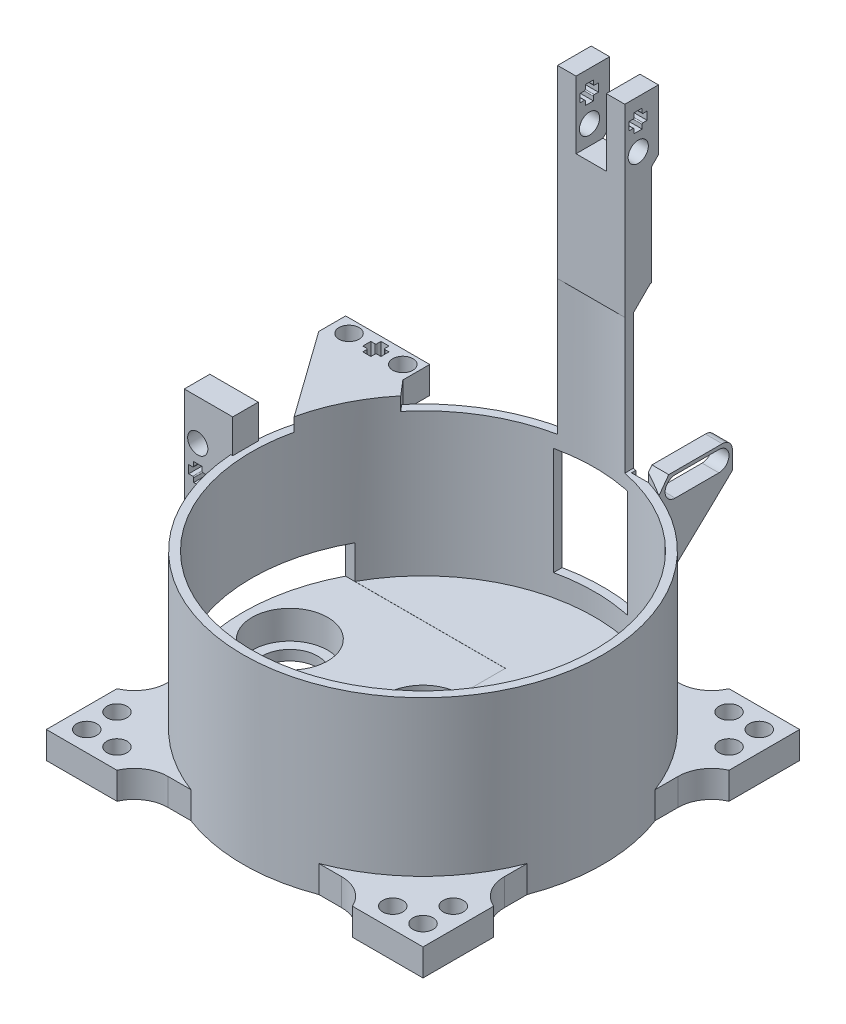
from build123d import *
from build123d.topology import SkipClean

# Parameters (mm, degrees)
SKETCH1_R                 = 53.5
SKETCH1_R_2               = 8.25
BOSS_EXTRUDE1_DEPTH       = 3
SKETCH2_R                 = 53.5
SKETCH2_R_2               = 11.25
BOSS_EXTRUDE2_DEPTH       = 8.5
SKETCH3_R                 = 53.5
SKETCH3_R_2               = 51
BOSS_EXTRUDE3_DEPTH       = 42.5
SKETCH6_W                 = 22
SKETCH6_H                 = 22
CUT_EXTRUDE1_DEPTH        = 85.5
SKETCH7_W                 = 49
SKETCH7_H                 = 10
CUT_EXTRUDE2_DEPTH        = 120
BOSS_EXTRUDE4_DEPTH       = 10
BOSS_EXTRUDE4_DEPTH_BACK  = 29
SKETCH8_W                 = 14.399157
SKETCH8_H                 = 7.6
SKETCH9_R                 = 3
CUT_EXTRUDE3_DEPTH        = 46
BOSS_EXTRUDE6_DEPTH       = 4
BOSS_EXTRUDE6_DEPTH_BACK  = 4
SKETCH12_R                = 3
BOSS_EXTRUDE7_START       = 0.1
BOSS_EXTRUDE7_DEPTH       = 0.1
CHAMFER1_START            = 48.189598
CHAMFER1_DEPTH            = 1.710402
CHAMFER1_START_2          = 25.9
CHAMFER1_2_DEPTH          = 22.289598
CHAMFER1_3_ANGLE          = 25.455109
SKETCH15_R                = 3
BOSS_EXTRUDE9_DEPTH       = 8
FILLET2_R                 = 10
BOSS_EXTRUDE10_DEPTH      = 95
BOSS_EXTRUDE13_DEPTH      = 10
BOSS_EXTRUDE13_DEPTH_BACK = 10
SKETCH19_R                = 3
CUT_EXTRUDE4_DEPTH        = 20
SKETCH20_W                = 9
SKETCH20_H                = 10
CUT_EXTRUDE5_DEPTH        = 20
BOSS_EXTRUDE14_START      = -8
BOSS_EXTRUDE14_DEPTH      = 8
CUT_EXTRUDE6_DEPTH        = 10
CHAMFER2_SIZE             = 21
FILLET3_R                 = 3
CUT_EXTRUDE7_REACH        = 180.543
CUT_EXTRUDE7_END_RADIUS   = 53.5
SKETCH27_W                = 22
SKETCH27_H                = 10


with BuildPart() as part:
    # Sketch1 → Boss-Extrude1 (new body)
    with BuildSketch(Plane(origin=(0, 0, 0), x_dir=(1, 0, 0), z_dir=(0, 1, 0))):
        with Locations(Location((0, 0, 0), (0, 0, 270))):
            Circle(SKETCH1_R)
        with Locations(Location((0, 0, 0), (0, 0, 270))):
            Circle(SKETCH1_R_2, mode=Mode.SUBTRACT)
        with Locations(Location((-39.59108, 0, 0), (0, 0, 270))):
            Circle(SKETCH1_R_2, mode=Mode.SUBTRACT)
    extrude(amount=BOSS_EXTRUDE1_DEPTH)

    # Sketch2 → Boss-Extrude2 (add)
    with BuildSketch(Plane(origin=(0, 3, 0), x_dir=(1, 0, 0), z_dir=(0, 1, 0))):
        with Locations(Location((0, 0, 0), (0, 0, 270))):
            Circle(SKETCH2_R)
        with Locations(Location((0, 0, 0), (0, 0, 270))):
            Circle(SKETCH2_R_2, mode=Mode.SUBTRACT)
        with Locations(Location((-39.59108, 0, 0), (0, 0, 270))):
            Circle(SKETCH2_R_2, mode=Mode.SUBTRACT)
    extrude(amount=BOSS_EXTRUDE2_DEPTH)

    # Sketch3 → Boss-Extrude3 (add)
    with BuildSketch(Plane(origin=(0, 11.5, 0), x_dir=(1, 0, 0), z_dir=(0, 1, 0))):
        with Locations(Location((0, 0, 0), (0, 0, 270))):
            Circle(SKETCH3_R)
        with Locations(Location((0, 0, 0), (0, 0, 270))):
            Circle(SKETCH3_R_2, mode=Mode.SUBTRACT)
    extrude(amount=BOSS_EXTRUDE3_DEPTH)

    # Sketch6 → Cut-Extrude1 (cut)
    with BuildSketch(Plane.XY):
        with Locations((0, 39)):
            Rectangle(SKETCH6_W, SKETCH6_H)
    extrude(amount=-CUT_EXTRUDE1_DEPTH, mode=Mode.SUBTRACT)

    # Sketch7 → Cut-Extrude2 (cut)
    with BuildSketch(Plane(origin=(0, 0, 0), x_dir=(0, 0, -1), z_dir=(1, 0, 0))):
        with Locations((0, 16.46402)):
            Rectangle(SKETCH7_W, SKETCH7_H)
    extrude(amount=-CUT_EXTRUDE2_DEPTH, mode=Mode.SUBTRACT)

    # Sketch8 → Boss-Extrude4 (add, two sides: drawn at the far end of the back side and taken through both)
    with BuildSketch(Plane(origin=(0, 54, 0), x_dir=(1, 0, 0), z_dir=(0, 1, 0)).offset(-BOSS_EXTRUDE4_DEPTH_BACK)):
        with Locations((-59.982582, 0)):
            Rectangle(SKETCH8_W, SKETCH8_H)
    extrude(amount=BOSS_EXTRUDE4_DEPTH + BOSS_EXTRUDE4_DEPTH_BACK)

    # Sketch9 → Cut-Extrude3 (cut)
    with BuildSketch(Plane(origin=(0, 0, -3.8), x_dir=(-1, 0, 0), z_dir=(0, 0, -1))):
        with BuildLine():
            Line((66.182161, 52), (63.182161, 52))
            Line((63.182161, 52), (63.182161, 55))
            ThreePointArc((63.182161, 55), (61.06084, 49.87868), (66.182161, 52))
        make_face()
        with BuildLine():
            Line((63.182161, 55), (63.182161, 52))
            Line((63.182161, 52), (66.182161, 52))
            ThreePointArc((66.182161, 52), (65.303481, 54.12132), (63.182161, 55))
        make_face()
        with BuildLine():
            Line((64.371816, 41.302276), (64.371816, 42.502276))
            ThreePointArc((64.371816, 42.502276), (64.459684, 42.714409), (64.671816, 42.802276))
            Line((64.671816, 42.802276), (65.871816, 42.802276))
            Line((65.871816, 42.802276), (65.871816, 45.202276))
            Line((65.871816, 45.202276), (64.671816, 45.202276))
            ThreePointArc((64.671816, 45.202276), (64.459684, 45.290144), (64.371816, 45.502276))
            Line((64.371816, 45.502276), (64.371816, 46.702276))
            Line((64.371816, 46.702276), (61.971816, 46.702276))
            Line((61.971816, 46.702276), (61.971816, 45.502276))
            ThreePointArc((61.971816, 45.502276), (61.883948, 45.290144), (61.671816, 45.202276))
            Line((61.671816, 45.202276), (60.471816, 45.202276))
            Line((60.471816, 45.202276), (60.471816, 42.802276))
            Line((60.471816, 42.802276), (61.671816, 42.802276))
            ThreePointArc((61.671816, 42.802276), (61.883948, 42.714409), (61.971816, 42.502276))
            Line((61.971816, 42.502276), (61.971816, 41.302276))
            Line((61.971816, 41.302276), (64.371816, 41.302276))
        make_face()
        with Locations((63.182161, 36)):
            Circle(SKETCH9_R)
    extrude(amount=-CUT_EXTRUDE3_DEPTH, mode=Mode.SUBTRACT)

    # Sketch12 → Boss-Extrude6 (add, two sides: drawn at the far end of the back side and taken through both)
    # profile 1 of 2: a face of its own
    with SkipClean():  # the faces are left unmerged after this step: merging them gives an invalid solid
        with BuildSketch(Plane(origin=(0, 54, 0), x_dir=(1, 0, 0), z_dir=(0, 1, 0)).offset(-BOSS_EXTRUDE6_DEPTH_BACK)):
            with BuildLine():
                Line((-43, 41), (-43, 45))
                Line((-43, 45), (-47, 45))
                Line((-47, 45), (-68, 45))
                Line((-68, 45), (-68, 37))
                Line((-68, 37), (-51.614712, 14.077339))
                ThreePointArc((-51.614712, 14.077339), (-47.35959, 24.886126), (-40.871779, 34.521698))
                Line((-40.871779, 34.521698), (-43, 37))
                Line((-43, 37), (-43, 41))
            make_face()
            with Locations(Location((-63, 41, 0), (0, 0, 270))):
                Circle(SKETCH12_R, mode=Mode.SUBTRACT)
            with BuildLine():
                Line((-56.497724, 39.789656), (-57.697724, 39.789656))
                Line((-57.697724, 39.789656), (-57.697724, 42.189656))
                Line((-57.697724, 42.189656), (-56.497724, 42.189656))
                ThreePointArc((-56.497724, 42.189656), (-56.285591, 42.277524), (-56.197724, 42.489656))
                Line((-56.197724, 42.489656), (-56.197724, 43.689656))
                Line((-56.197724, 43.689656), (-53.797724, 43.689656))
                Line((-53.797724, 43.689656), (-53.797724, 42.489656))
                ThreePointArc((-53.797724, 42.489656), (-53.709856, 42.277524), (-53.497724, 42.189656))
                Line((-53.497724, 42.189656), (-52.297724, 42.189656))
                Line((-52.297724, 42.189656), (-52.297724, 39.789656))
                Line((-52.297724, 39.789656), (-53.497724, 39.789656))
                ThreePointArc((-53.497724, 39.789656), (-53.709856, 39.701788), (-53.797724, 39.489656))
                Line((-53.797724, 39.489656), (-53.797724, 38.289656))
                Line((-53.797724, 38.289656), (-56.197724, 38.289656))
                Line((-56.197724, 38.289656), (-56.197724, 39.489656))
                ThreePointArc((-56.197724, 39.489656), (-56.285591, 39.701788), (-56.497724, 39.789656))
            make_face(mode=Mode.SUBTRACT)
            with Locations(Location((-47, 41, 0), (0, 0, 270))):
                Circle(SKETCH12_R, mode=Mode.SUBTRACT)
        # profile 2 of 2: a face of its own
        with BuildSketch(Plane(origin=(0, 54, 0), x_dir=(1, 0, 0), z_dir=(0, 1, 0)).offset(-BOSS_EXTRUDE6_DEPTH_BACK)):
            with BuildLine():
                Line((-39.220961, 32.599329), (-40.871779, 34.521698))
                ThreePointArc((-40.871779, 34.521698), (-47.35959, 24.886126), (-51.614712, 14.077339))
                Line((-51.614712, 14.077339), (-49.70746, 11.409136))
                ThreePointArc((-49.70746, 11.409136), (-45.709103, 22.620298), (-39.220961, 32.599329))
            make_face()
        extrude(amount=BOSS_EXTRUDE6_DEPTH + BOSS_EXTRUDE6_DEPTH_BACK)

    # Sketch14 → Boss-Extrude7 (add)
    with SkipClean():  # the faces are left unmerged after this step: merging them gives an invalid solid
        with BuildSketch(Plane.XZ.offset(-50).offset(BOSS_EXTRUDE7_START)):
            with BuildLine():
                Line((-68, -37), (-43, -37))
                Line((-43, -37), (-40.871779, -34.521698))
                ThreePointArc((-40.871779, -34.521698), (-47.35959, -24.886126), (-51.614712, -14.077339))
                Line((-51.614712, -14.077339), (-68, -37))
            make_face()
        extrude(amount=-BOSS_EXTRUDE7_DEPTH)

    # Chamfer1: read off the stored shape, not the designer's step
    # Chamfer1 outline → Chamfer1 (add)
    with SkipClean():  # the faces are left unmerged after this step: merging them gives an invalid solid
        with BuildSketch(Plane(origin=(0, 0, 0), x_dir=(1, 0, 0), z_dir=(0, 1, 0)).offset(CHAMFER1_START)):
            with BuildLine():
                ThreePointArc((-51.614712, 14.077339), (-47.35959, 24.886126), (-40.871779, 34.521698))
                Line((-40.871779, 34.521698), (-43, 37))
                Line((-43, 37), (-68, 37))
                Line((-68, 37), (-51.614712, 14.077339))
            make_face()
        extrude(amount=CHAMFER1_DEPTH)

    # Chamfer1 2 outline → Chamfer1 2 (add)
    with SkipClean():  # the faces are left unmerged after this step: merging them gives an invalid solid
        with BuildSketch(Plane(origin=(0, 0, 0), x_dir=(1, 0, 0), z_dir=(0, 1, 0)).offset(CHAMFER1_START_2)):
            with BuildLine():
                ThreePointArc((-51.614712, 14.077339), (-47.35959, 24.886126), (-40.871779, 34.521698))
                Line((-40.871779, 34.521698), (-43, 37))
                Line((-43, 37), (-68, 37))
                Line((-68, 37), (-51.614712, 14.077339))
            make_face()
        extrude(amount=CHAMFER1_2_DEPTH)

    # Chamfer1 3 outline → Chamfer1 3 (revolve, cut)
    with SkipClean():  # the faces are left unmerged after this step: merging them gives an invalid solid
        with BuildSketch(Plane(origin=(0, 0, 0), x_dir=(-0.7580108737829231, 0, -0.6522419146504228), z_dir=(0.6522419146504228, 0, -0.7580108737829231))):
            Polygon((77.414469, 49.814469), (53.5, 25.9), (77.414469, 25.9), align=None)
        revolve(axis=Axis((0, 0, 0), (0, 1, 0)), revolution_arc=CHAMFER1_3_ANGLE, mode=Mode.SUBTRACT)

    # Sketch15 → Boss-Extrude9 (add)
    # profile 1 of 4: a face of its own
    with SkipClean():  # the faces are left unmerged after this step: merging them gives an invalid solid
        with BuildSketch(Plane.XZ):
            with BuildLine():
                Line((-35, -50), (-19.032866, -50))
                ThreePointArc((-19.032866, -50), (-37.830213, -37.830213), (-50, -19.032866))
                Line((-50, -19.032866), (-50, -35))
                Line((-50, -35), (-56, -35))
                Line((-56, -35), (-56, -56))
                Line((-56, -56), (-35, -56))
                Line((-35, -56), (-35, -50))
            make_face()
            with Locations(Location((-50, -50, 0), (0, 0, 270))):
                Circle(SKETCH15_R, mode=Mode.SUBTRACT)
            with Locations(Location((-41, -50, 0), (0, 0, 270))):
                Circle(SKETCH15_R, mode=Mode.SUBTRACT)
            with BuildLine():
                ThreePointArc((-50, -44), (-52.12132, -38.87868), (-47, -41))
                ThreePointArc((-47, -41), (-47.87868, -43.12132), (-50, -44))
            make_face(mode=Mode.SUBTRACT)
        # profile 2 of 4: a face of its own
        with BuildSketch(Plane.XZ):
            with BuildLine():
                Line((-50, 35), (-50, 19.032866))
                ThreePointArc((-50, 19.032866), (-37.830213, 37.830213), (-19.032866, 50))
                Line((-19.032866, 50), (-35, 50))
                Line((-35, 50), (-35, 56))
                Line((-35, 56), (-56, 56))
                Line((-56, 56), (-56, 35))
                Line((-56, 35), (-50, 35))
            make_face()
            with BuildLine():
                ThreePointArc((-50, 44), (-47.87868, 43.12132), (-47, 41))
                ThreePointArc((-47, 41), (-52.12132, 38.87868), (-50, 44))
            make_face(mode=Mode.SUBTRACT)
            with Locations(Location((-50, 50, 0), (0, 0, 270))):
                Circle(SKETCH15_R, mode=Mode.SUBTRACT)
            with Locations(Location((-41, 50, 0), (0, 0, 270))):
                Circle(SKETCH15_R, mode=Mode.SUBTRACT)
        # profile 3 of 4: a face of its own
        with BuildSketch(Plane.XZ):
            with BuildLine():
                ThreePointArc((19.032866, 50), (37.830213, 37.830213), (50, 19.032866))
                Line((50, 19.032866), (50, 35))
                Line((50, 35), (56, 35))
                Line((56, 35), (56, 56))
                Line((56, 56), (35, 56))
                Line((35, 56), (35, 50))
                Line((35, 50), (19.032866, 50))
            make_face()
            with BuildLine():
                ThreePointArc((50, 44), (52.12132, 43.12132), (53, 41))
                ThreePointArc((53, 41), (47.87868, 38.87868), (50, 44))
            make_face(mode=Mode.SUBTRACT)
            with Locations(Location((41, 50, 0), (0, 0, 270))):
                Circle(SKETCH15_R, mode=Mode.SUBTRACT)
            with Locations(Location((50, 50, 0), (0, 0, 270))):
                Circle(SKETCH15_R, mode=Mode.SUBTRACT)
        # profile 4 of 4: a face of its own
        with BuildSketch(Plane.XZ):
            with BuildLine():
                Line((50, -35), (50, -19.032866))
                ThreePointArc((50, -19.032866), (37.830213, -37.830213), (19.032866, -50))
                Line((19.032866, -50), (35, -50))
                Line((35, -50), (35, -56))
                Line((35, -56), (56, -56))
                Line((56, -56), (56, -35))
                Line((56, -35), (50, -35))
            make_face()
            with Locations(Location((41, -50, 0), (0, 0, 270))):
                Circle(SKETCH15_R, mode=Mode.SUBTRACT)
            with Locations(Location((50, -50, 0), (0, 0, 270))):
                Circle(SKETCH15_R, mode=Mode.SUBTRACT)
            with BuildLine():
                ThreePointArc((50, -44), (47.87868, -38.87868), (53, -41))
                ThreePointArc((53, -41), (52.12132, -43.12132), (50, -44))
            make_face(mode=Mode.SUBTRACT)
        extrude(amount=-BOSS_EXTRUDE9_DEPTH)

    # Fillet2
    # the kernel refuses this fillet: 10 mm, written as the material it adds along each edge
    with BuildSketch(Plane(origin=(-35, 0, -50), x_dir=(1, 0, 0), z_dir=(0, 1, 0)), Plane(origin=(-50, 0, 35), x_dir=(0, 0, -1), z_dir=(0, 1, 0)), Plane(origin=(35, 0, 50), x_dir=(-1, 0, 0), z_dir=(0, 1, 0)), Plane(origin=(50, 0, -35), x_dir=(0, 0, 1), z_dir=(0, 1, 0))) as fillet2_piece_1:
        with BuildLine():
            CenterArc((9.165151, 10), FILLET2_R, 203.578178, 66.421822)
            Line((0, 6), (-0.183303, 5.92))
            ThreePointArc((-0.183303, 5.92), (-0.2, 3), (-0.2, 0))
            Line((-0.2, 0), (0, -0.2))
            Line((0, -0.2), (9.165151, -0.2))
            Line((9.165151, -0.2), (9.165151, 0))
        make_face()
    extrude(amount=8)
    with BuildSketch(Plane(origin=(-50, 0, -35), x_dir=(0, 0, 1), z_dir=(0, 1, 0)), Plane(origin=(-35, 0, 50), x_dir=(1, 0, 0), z_dir=(0, 1, 0)), Plane(origin=(50, 0, 35), x_dir=(0, 0, -1), z_dir=(0, 1, 0)), Plane(origin=(35, 0, -50), x_dir=(-1, 0, 0), z_dir=(0, 1, 0))) as fillet2_piece_2:
        with BuildLine():
            CenterArc((9.165151, -10), FILLET2_R, 90, 66.421822)
            Line((0, -6), (-0.183303, -5.92))
            ThreePointArc((-0.183303, -5.92), (-0.2, -3), (-0.2, 0))
            Line((-0.2, 0), (0, 0.2))
            Line((0, 0.2), (9.165151, 0.2))
            Line((9.165151, 0.2), (9.165151, 0))
        make_face()
    extrude(amount=8)

    # Sketch17 → Boss-Extrude10 (add)
    with BuildSketch(Plane(origin=(0, 54, 0), x_dir=(1, 0, 0), z_dir=(0, 1, 0))):
        with BuildLine():
            Line((10, 52.557112), (10, 50.009999))
            ThreePointArc((10, 50.009999), (0, 51), (-10, 50.009999))
            Line((-10, 50.009999), (-10, 52.557112))
            ThreePointArc((-10, 52.557112), (0, 53.5), (10, 52.557112))
        make_face()
    extrude(amount=BOSS_EXTRUDE10_DEPTH)

    # Sketch18 → Boss-Extrude13 (add, two sides: drawn at the far end of the back side and taken through both)
    with BuildSketch(Plane(origin=(0, 0, 0), x_dir=(0, 0, -1), z_dir=(1, 0, 0)).offset(-BOSS_EXTRUDE13_DEPTH_BACK)):
        Polygon((52.557112, 94), (50.009999, 94.10615), (50.009999, 149), (60.009999, 149), (60.009999, 131), (58.009999, 129), (58.009999, 99), (57.557112, 99), align=None)
    extrude(amount=BOSS_EXTRUDE13_DEPTH + BOSS_EXTRUDE13_DEPTH_BACK)

    # Sketch19 → Cut-Extrude4 (cut)
    with BuildSketch(Plane(origin=(10, 0, 0), x_dir=(0, 0, -1), z_dir=(1, 0, 0))):
        with Locations(Location((54.009999, 134.776006, 0), (0, 0, 180))):
            Circle(SKETCH19_R)
        with BuildLine():
            Line((51.255492, 143.937933), (51.255492, 141.537933))
            Line((51.255492, 141.537933), (52.455492, 141.537933))
            ThreePointArc((52.455492, 141.537933), (52.667624, 141.450065), (52.755492, 141.237933))
            Line((52.755492, 141.237933), (52.755492, 140.037933))
            Line((52.755492, 140.037933), (55.155492, 140.037933))
            Line((55.155492, 140.037933), (55.155492, 141.237933))
            ThreePointArc((55.155492, 141.237933), (55.24336, 141.450065), (55.455492, 141.537933))
            Line((55.455492, 141.537933), (56.655492, 141.537933))
            Line((56.655492, 141.537933), (56.655492, 143.937933))
            Line((56.655492, 143.937933), (55.455492, 143.937933))
            ThreePointArc((55.455492, 143.937933), (55.24336, 144.025801), (55.155492, 144.237933))
            Line((55.155492, 144.237933), (55.155492, 145.437933))
            Line((55.155492, 145.437933), (52.755492, 145.437933))
            Line((52.755492, 145.437933), (52.755492, 144.237933))
            ThreePointArc((52.755492, 144.237933), (52.667624, 144.025801), (52.455492, 143.937933))
            Line((52.455492, 143.937933), (51.255492, 143.937933))
        make_face()
    extrude(amount=-CUT_EXTRUDE4_DEPTH, mode=Mode.SUBTRACT)

    # Sketch20 → Cut-Extrude5 (cut)
    with BuildSketch(Plane(origin=(0, 149, 0), x_dir=(1, 0, 0), z_dir=(0, 1, 0))):
        with Locations((0, 55.009999)):
            Rectangle(SKETCH20_W, SKETCH20_H)
    extrude(amount=-CUT_EXTRUDE5_DEPTH, mode=Mode.SUBTRACT)

    # Sketch23 → Boss-Extrude14 (add)
    with BuildSketch(Plane(origin=(0, 58, 0), x_dir=(1, 0, 0), z_dir=(0, 1, 0)).offset(BOSS_EXTRUDE14_START)):
        with BuildLine():
            Line((15.903513, 51.081584), (15.903513, 71.081584))
            Line((15.903513, 71.081584), (20.903513, 71.081584))
            Line((20.903513, 71.081584), (20.903513, 49.247265))
            ThreePointArc((20.903513, 49.247265), (18.426353, 50.226681), (15.903513, 51.081584))
        make_face()
    extrude(amount=BOSS_EXTRUDE14_DEPTH)

    # Sketch25 → Cut-Extrude6 (cut)
    with BuildSketch(Plane(origin=(20.903513, 0, 0), x_dir=(0, 0, -1), z_dir=(1, 0, 0))):
        with BuildLine():
            Line((54.081584, 57), (67.081584, 57))
            ThreePointArc((67.081584, 57), (70.081584, 54), (67.081584, 51))
            Line((67.081584, 51), (54.081584, 51))
            ThreePointArc((54.081584, 51), (51.081584, 54), (54.081584, 57))
        make_face()
        Polygon((49.247265, 58), (49.247265, 54), (52.16622, 58), align=None)
    extrude(amount=-CUT_EXTRUDE6_DEPTH, mode=Mode.SUBTRACT)

    # Chamfer2
    # the kernel refuses this chamfer: 21 mm, written as the material it adds along each edge
    with BuildSketch(Plane(origin=(0, 50, 0), x_dir=(0.9872375521222557, 0, -0.15925456250813172), z_dir=(0.15925456250813172, 0, 0.9872375521222557))) as chamfer2_piece_1_section:
        Polygon((53.5, -CHAMFER2_SIZE), (53.5 + CHAMFER2_SIZE, 0), (53.5, 0), align=None)
    chamfer2_piece_1 = revolve(axis=Axis((0, 50, 0), (0, 1, 0)), revolution_arc=121.380216, mode=Mode.PRIVATE)
    chamfer2_piece_1 = split(chamfer2_piece_1, bisect_by=Plane(origin=(15.903513, 50, 0), z_dir=(1, 0, 0)), keep=Keep.TOP, mode=Mode.PRIVATE)
    chamfer2_piece_1 = split(chamfer2_piece_1, bisect_by=Plane(origin=(20.903513, 50, 0), z_dir=(-1, 0, 0)), keep=Keep.TOP, mode=Mode.PRIVATE)
    chamfer2_piece_1 = split(chamfer2_piece_1, bisect_by=Plane(origin=(0, 50, -71.081584), z_dir=(0, 0, 1)), keep=Keep.TOP, mode=Mode.PRIVATE)
    add(chamfer2_piece_1)

    # Fillet3
    fillet3_edges = [part.edges().sort_by_distance(p)[0] for p in [
        (18.403513, 58, -71.081584),
    ]]
    fillet(fillet3_edges, radius=FILLET3_R)

    # Cut-Extrude7: up to this cylinder (the profile starts inside it)
    cut_extrude7_end = Plane(origin=(0, 23, 0), z_dir=(0, -1, 0)) * Cylinder(CUT_EXTRUDE7_END_RADIUS, 469.086, mode=Mode.PRIVATE)
    # Sketch27 → Cut-Extrude7 (cut, up to the surface)
    with BuildSketch(Plane.XY, mode=Mode.PRIVATE) as cut_extrude7_sk1:
        with Locations((0, 23)):
            Rectangle(SKETCH27_W, SKETCH27_H)
    cut_extrude7_tool1 = extrude(cut_extrude7_sk1.sketch, amount=-CUT_EXTRUDE7_REACH, mode=Mode.PRIVATE) & cut_extrude7_end
    add(cut_extrude7_tool1.solids().sort_by_distance((0, 23, 0))[0], mode=Mode.SUBTRACT)


solid = part.part
